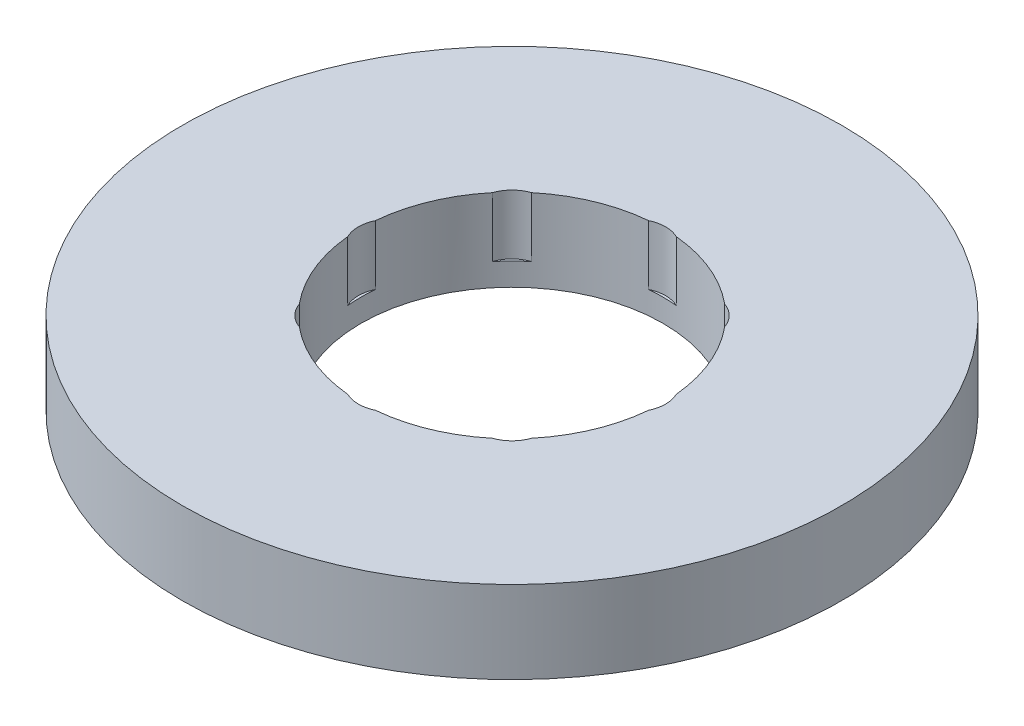
from build123d import *

# Parameters (mm, degrees)
SKETCH1_R           = 60
BOSS_EXTRUDE1_DEPTH = 15
SKETCH2_R           = 27.5
CUT_EXTRUDE1_DEPTH  = 87.168439698
SKETCH3_R           = 5.77723652
CUT_EXTRUDE2_DEPTH  = 10.863237511
CIRPATTERN1_COUNT   = 8


with BuildPart() as part:
    # Sketch1 → Boss-Extrude1 (new body)
    with BuildSketch(Plane(origin=(0, 0, 0), x_dir=(1, 0, 0), z_dir=(0, 1, 0))):
        Circle(SKETCH1_R)
    extrude(amount=BOSS_EXTRUDE1_DEPTH)

    # Sketch2 → Cut-Extrude1 (cut, through all)
    with BuildSketch(Plane(origin=(0, 0, 0), x_dir=(1, 0, 0), z_dir=(0, 1, 0))):
        Circle(SKETCH2_R)
    extrude(amount=CUT_EXTRUDE1_DEPTH, mode=Mode.SUBTRACT)

    # Sketch3 → Cut-Extrude2 (cut)
    with BuildSketch(Plane(origin=(0, 15, 0), x_dir=(1, 0, 0), z_dir=(0, 1, 0))):
        with Locations((-22.187335829, 0)):
            Circle(SKETCH3_R)
    cut_extrude2 = extrude(amount=-CUT_EXTRUDE2_DEPTH, mode=Mode.SUBTRACT)

    # CirPattern1: Cut-Extrude2 ×8 about axis
    cirpattern1_axis = Axis((0, 0, 0), (0, 1, 0))
    for i in range(1, CIRPATTERN1_COUNT):
        add(cut_extrude2.rotate(cirpattern1_axis, i * 360 / CIRPATTERN1_COUNT), mode=Mode.SUBTRACT)


solid = part.part
